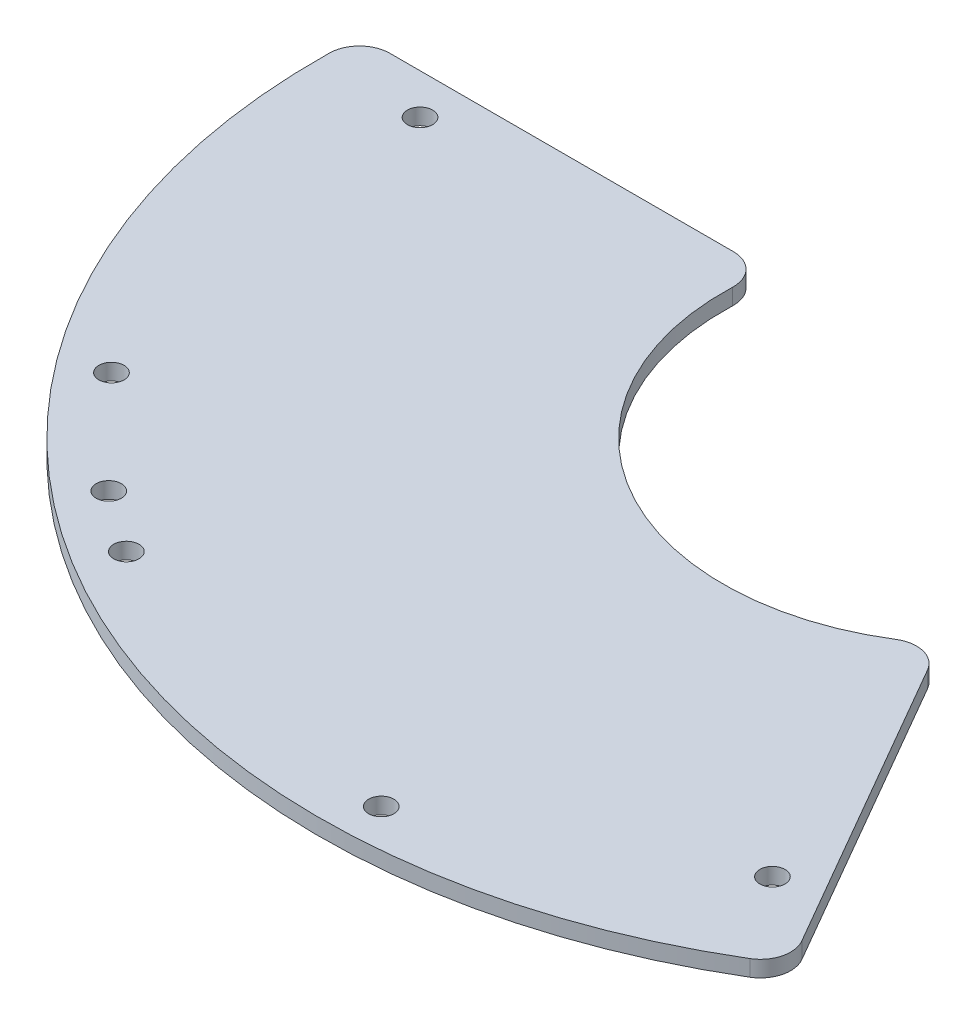
from build123d import *

# Parameters (mm, degrees)
SKETCH1_R           = 1.25
BOSS_EXTRUDE1_DEPTH = 0.8
FILLET1_R           = 3


with BuildPart() as part:
    # Sketch1 → Boss-Extrude1 (new, symmetric)
    with BuildSketch(Plane(origin=(0, 0, 0), x_dir=(1, 0, 0), z_dir=(0, 1, 0))):
        with BuildLine():
            Line((-64.876806333, 4), (-24.677925359, 4))
            ThreePointArc((-24.677925359, 4), (-12.5, -21.650635095), (15.803064294, -19.371710273))
            Line((15.803064294, -19.371710273), (35.902504782, -54.184962401))
            ThreePointArc((35.902504782, -54.184962401), (-32.5, -56.291651246), (-64.876806333, 4))
        make_face()
        with Locations((-55, 0)):
            Circle(SKETCH1_R, mode=Mode.SUBTRACT)
        with Locations((27.5, -47.631397208)):
            Circle(SKETCH1_R, mode=Mode.SUBTRACT)
        with Locations((2.128869299, -60.962840448)):
            Circle(SKETCH1_R, mode=Mode.SUBTRACT)
        with Locations((-32.325075118, -51.730933866)):
            Circle(SKETCH1_R, mode=Mode.SUBTRACT)
        with Locations((-38.388543854, -47.405903649)):
            Circle(SKETCH1_R, mode=Mode.SUBTRACT)
        with Locations((-48.394553758, -37.13444717)):
            Circle(SKETCH1_R, mode=Mode.SUBTRACT)
    extrude(amount=BOSS_EXTRUDE1_DEPTH, both=True)

    # Fillet1
    fillet1_edges = [part.edges().sort_by_distance(p)[0] for p in [
        (-64.876806333, 0, -4),
        (-24.677925359, 0, -4),
        (35.902504782, 0, 54.184962401),
        (15.803064294, 0, 19.371710273),
    ]]
    fillet(fillet1_edges, radius=FILLET1_R)


solid = part.part
